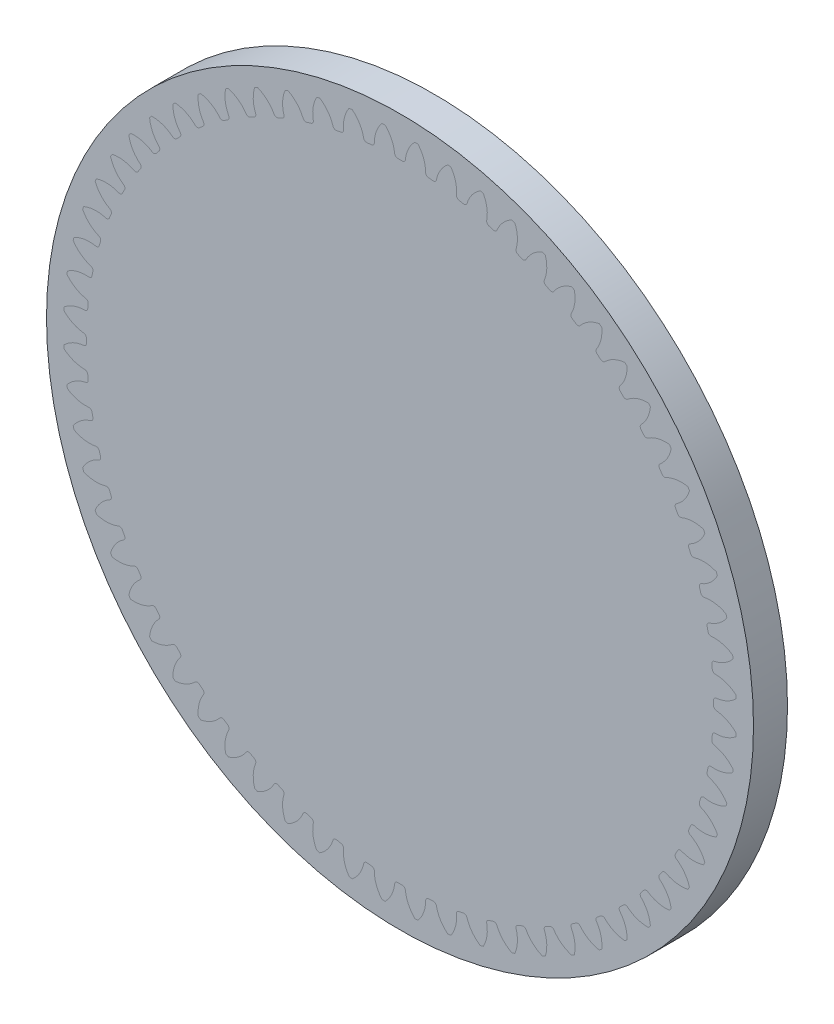
from build123d import *

# Parameters (mm, degrees)
SKETCH1_R                = 99
BOSS_EXTRUDE1_DEPTH      = 5
CUT_EXTRUDE1_DEPTH       = 141.096395385
FILLET1_R                = 0.9
CIRPATTERN1_COUNT        = 64
FILLET1_OF_CIRPATTERN1_R = 0.9
SKETCH3_R                = 104
BOSS_EXTRUDE2_DEPTH      = 5


with BuildPart() as part:
    # Sketch1 → Boss-Extrude1 (new, symmetric)
    with BuildSketch(Plane.XY):
        Circle(SKETCH1_R)
    extrude(amount=BOSS_EXTRUDE1_DEPTH, both=True)

    # Sketch2 → Cut-Extrude1 (cut, symmetric)
    with BuildSketch(Plane.XY):
        with BuildLine():
            ThreePointArc((-5.510991501, 99.848029388), (-2.618675254, 96.514378623), (-1.529900668, 92.23731297))
            ThreePointArc((-1.529900668, 92.23731297), (0, 92.25), (1.529900668, 92.23731297))
            ThreePointArc((1.529900668, 92.23731297), (2.618675254, 96.514378623), (5.510991501, 99.848029388))
            ThreePointArc((5.510991501, 99.848029388), (0, 100), (-5.510991501, 99.848029388))
        make_face()
    cut_extrude1 = extrude(amount=CUT_EXTRUDE1_DEPTH, both=True, mode=Mode.SUBTRACT)

    # Fillet1
    fillet1_edges = [part.edges().sort_by_distance(p)[0] for p in [
        (1.529900668, 92.23731297, 0),
        (-1.529900668, 92.23731297, 0),
    ]]
    fillet(fillet1_edges, radius=FILLET1_R)

    # CirPattern1: Cut-Extrude1 ×64 about axis
    cirpattern1_axis = Axis((0, 0, 5), (0, 0, 1))
    for i in range(1, CIRPATTERN1_COUNT):
        add(cut_extrude1.rotate(cirpattern1_axis, i * 360 / CIRPATTERN1_COUNT), mode=Mode.SUBTRACT)

    # Fillet1 of CirPattern1
    fillet1_of_cirpattern1_edges = [part.edges().sort_by_distance(p)[0] for p in [
        (-7.518303871, 91.943121586, 0),
        (-10.563371427, 91.643208609, 0),
        (-16.494103034, 90.763467679, 0),
        (-19.495111144, 90.166530051, 0),
        (-25.311054968, 88.709711962, 0),
        (-28.239102285, 87.821498519, 0),
        (-33.884247606, 85.801633226, 0),
        (-36.711135433, 84.630697948, 0),
        (-42.131116417, 82.067237857, 0),
        (-44.829620279, 80.624857492, 0),
        (-49.972239545, 77.542490125, 0),
        (-52.516371375, 75.842555585, 0),
        (-57.332102689, 72.270965825, 0),
        (-59.697361106, 70.329848407, 0),
        (-64.139826343, 66.303432616, 0),
        (-66.303432616, 64.139826343, 0),
        (-70.329848407, 59.697361106, 0),
        (-72.270965825, 57.332102689, 0),
        (-75.842555585, 52.516371375, 0),
        (-77.542490125, 49.972239545, 0),
        (-80.624857492, 44.829620279, 0),
        (-82.067237857, 42.131116417, 0),
        (-84.630697948, 36.711135433, 0),
        (-85.801633226, 33.884247606, 0),
        (-87.821498519, 28.239102285, 0),
        (-88.709711962, 25.311054968, 0),
        (-90.166530051, 19.495111144, 0),
        (-90.763467679, 16.494103034, 0),
        (-91.643208609, 10.563371427, 0),
        (-91.943121586, 7.518303871, 0),
        (-92.23731297, 1.529900668, 0),
        (-92.23731297, -1.529900668, 0),
        (-91.943121586, -7.518303871, 0),
        (-91.643208609, -10.563371427, 0),
        (-90.763467679, -16.494103034, 0),
        (-90.166530051, -19.495111144, 0),
        (-88.709711962, -25.311054968, 0),
        (-87.821498519, -28.239102285, 0),
        (-85.801633226, -33.884247606, 0),
        (-84.630697948, -36.711135433, 0),
        (-82.067237857, -42.131116417, 0),
        (-80.624857492, -44.829620279, 0),
        (-77.542490125, -49.972239545, 0),
        (-75.842555585, -52.516371375, 0),
        (-72.270965825, -57.332102689, 0),
        (-70.329848407, -59.697361106, 0),
        (-66.303432616, -64.139826343, 0),
        (-64.139826343, -66.303432616, 0),
        (-59.697361106, -70.329848407, 0),
        (-57.332102689, -72.270965825, 0),
        (-52.516371375, -75.842555585, 0),
        (-49.972239545, -77.542490125, 0),
        (-44.829620279, -80.624857492, 0),
        (-42.131116417, -82.067237857, 0),
        (-36.711135433, -84.630697948, 0),
        (-33.884247606, -85.801633226, 0),
        (-28.239102285, -87.821498519, 0),
        (-25.311054968, -88.709711962, 0),
        (-19.495111144, -90.166530051, 0),
        (-16.494103034, -90.763467679, 0),
        (-10.563371427, -91.643208609, 0),
        (-7.518303871, -91.943121586, 0),
        (-1.529900668, -92.23731297, 0),
        (1.529900668, -92.23731297, 0),
        (7.518303871, -91.943121586, 0),
        (10.563371427, -91.643208609, 0),
        (16.494103034, -90.763467679, 0),
        (19.495111144, -90.166530051, 0),
        (25.311054968, -88.709711962, 0),
        (28.239102285, -87.821498519, 0),
        (33.884247606, -85.801633226, 0),
        (36.711135433, -84.630697948, 0),
        (42.131116417, -82.067237857, 0),
        (44.829620279, -80.624857492, 0),
        (49.972239545, -77.542490125, 0),
        (52.516371375, -75.842555585, 0),
        (57.332102689, -72.270965825, 0),
        (59.697361106, -70.329848407, 0),
        (64.139826343, -66.303432616, 0),
        (66.303432616, -64.139826343, 0),
        (70.329848407, -59.697361106, 0),
        (72.270965825, -57.332102689, 0),
        (75.842555585, -52.516371375, 0),
        (77.542490125, -49.972239545, 0),
        (80.624857492, -44.829620279, 0),
        (82.067237857, -42.131116417, 0),
        (84.630697948, -36.711135433, 0),
        (85.801633226, -33.884247606, 0),
        (87.821498519, -28.239102285, 0),
        (88.709711962, -25.311054968, 0),
        (90.166530051, -19.495111144, 0),
        (90.763467679, -16.494103034, 0),
        (91.643208609, -10.563371427, 0),
        (91.943121586, -7.518303871, 0),
        (92.23731297, -1.529900668, 0),
        (92.23731297, 1.529900668, 0),
        (91.943121586, 7.518303871, 0),
        (91.643208609, 10.563371427, 0),
        (90.763467679, 16.494103034, 0),
        (90.166530051, 19.495111144, 0),
        (88.709711962, 25.311054968, 0),
        (87.821498519, 28.239102285, 0),
        (85.801633226, 33.884247606, 0),
        (84.630697948, 36.711135433, 0),
        (82.067237857, 42.131116417, 0),
        (80.624857492, 44.829620279, 0),
        (77.542490125, 49.972239545, 0),
        (75.842555585, 52.516371375, 0),
        (72.270965825, 57.332102689, 0),
        (70.329848407, 59.697361106, 0),
        (66.303432616, 64.139826343, 0),
        (64.139826343, 66.303432616, 0),
        (59.697361106, 70.329848407, 0),
        (57.332102689, 72.270965825, 0),
        (52.516371375, 75.842555585, 0),
        (49.972239545, 77.542490125, 0),
        (44.829620279, 80.624857492, 0),
        (42.131116417, 82.067237857, 0),
        (36.711135433, 84.630697948, 0),
        (33.884247606, 85.801633226, 0),
        (28.239102285, 87.821498519, 0),
        (25.311054968, 88.709711962, 0),
        (19.495111144, 90.166530051, 0),
        (16.494103034, 90.763467679, 0),
        (10.563371427, 91.643208609, 0),
        (7.518303871, 91.943121586, 0),
    ]]
    fillet(fillet1_of_cirpattern1_edges, radius=FILLET1_OF_CIRPATTERN1_R)


with BuildPart() as body_2:
    # Sketch3 → Boss-Extrude2 (new, symmetric)
    with BuildSketch(Plane.XY):
        Circle(SKETCH3_R)
        with BuildLine():
            ThreePointArc((-5.326203619, 98.8566212), (-6.970296204, 96.003625646), (-7.550059318, 92.762252667))
            ThreePointArc((-7.550059318, 92.762252667), (-7.786660643, 92.157733228), (-8.368408763, 91.869648061))
            ThreePointArc((-8.368408763, 91.869648061), (-9.042081195, 91.805791036), (-9.715267088, 91.736994094))
            ThreePointArc((-9.715267088, 91.736994094), (-10.34203971, 91.906050358), (-10.692030698, 92.452795496))
            ThreePointArc((-10.692030698, 92.452795496), (-11.893014325, 95.51878023), (-14.062107954, 97.996209722))
            ThreePointArc((-14.062107954, 97.996209722), (-14.526316971, 97.928474487), (-14.990199805, 97.858540301))
            ThreePointArc((-14.990199805, 97.858540301), (-16.34673317, 94.858133447), (-16.605994456, 91.575541842))
            ThreePointArc((-16.605994456, 91.575541842), (-16.782203214, 90.950742344), (-17.332912774, 90.607023099))
            ThreePointArc((-17.332912774, 90.607023099), (-17.997082206, 90.477442117), (-18.660283245, 90.342992696))
            ThreePointArc((-18.660283245, 90.342992696), (-19.300608197, 90.449800447), (-19.702504278, 90.959607743))
            ThreePointArc((-19.702504278, 90.959607743), (-21.198223896, 93.893111941), (-23.5997033, 96.146003579))
            ThreePointArc((-23.5997033, 96.146003579), (-24.05503781, 96.033094066), (-24.509832173, 95.918028164))
            ThreePointArc((-24.509832173, 95.918028164), (-25.565742159, 92.799105568), (-25.502004789, 89.506908489))
            ThreePointArc((-25.502004789, 89.506908489), (-25.616123994, 88.867846093), (-26.130491359, 88.471802973))
            ThreePointArc((-26.130491359, 88.471802973), (-26.778761477, 88.277745971), (-27.425590674, 88.078938891))
            ThreePointArc((-27.425590674, 88.078938891), (-28.073301276, 88.122469513), (-28.523231971, 88.590429243))
            ThreePointArc((-28.523231971, 88.590429243), (-30.299282983, 91.363201657), (-32.910020603, 93.369858862))
            ThreePointArc((-32.910020603, 93.369858862), (-33.352095486, 93.212862453), (-33.793421459, 93.053772982))
            ThreePointArc((-33.793421459, 93.053772982), (-34.538539076, 89.846371573), (-34.152416875, 86.576274678))
            ThreePointArc((-34.152416875, 86.576274678), (-34.203347496, 85.929103904), (-34.676419028, 85.484551022))
            ThreePointArc((-34.676419028, 85.484551022), (-35.302546636, 85.227886874), (-35.926774672, 84.966636756))
            ThreePointArc((-35.926774672, 84.966636756), (-36.575633118, 84.946471026), (-37.069265348, 85.368076481))
            ThreePointArc((-37.069265348, 85.368076481), (-39.108543412, 87.953413797), (-41.903396417, 89.694511363))
            ThreePointArc((-41.903396417, 89.694511363), (-42.32795425, 89.494940019), (-42.751561622, 89.293359097))
            ThreePointArc((-42.751561622, 89.293359097), (-43.17871098, 86.028367905), (-42.473922518, 82.811864014))
            ThreePointArc((-42.473922518, 82.811864014), (-42.461174065, 82.16281747), (-42.888393826, 81.674036113))
            ThreePointArc((-42.888393826, 81.674036113), (-43.486348972, 81.357236636), (-44.081964191, 81.036059462))
            ThreePointArc((-44.081964191, 81.036059462), (-44.725721618, 80.952391586), (-45.258301436, 81.323582476))
            ThreePointArc((-45.258301436, 81.323582476), (-47.541167188, 83.696586482), (-50.493219617, 85.155356688))
            ThreePointArc((-50.493219617, 85.155356688), (-50.896171675, 84.91513239), (-51.297980877, 84.673001352))
            ThreePointArc((-51.297980877, 84.673001352), (-51.403048294, 81.381864026), (-50.386381067, 78.24992983))
            ThreePointArc((-50.386381067, 78.24992983), (-50.310076316, 77.60525819), (-50.687329946, 77.076955589))
            ThreePointArc((-50.687329946, 77.076955589), (-51.251353996, 76.703071735), (-51.812620296, 76.325060616))
            ThreePointArc((-51.812620296, 76.325060616), (-52.44507697, 76.178696361), (-53.011475339, 76.495897915))
            ThreePointArc((-53.011475339, 76.495897915), (-55.515943536, 78.633715286), (-58.59676551, 79.796109377))
            ThreePointArc((-58.59676551, 79.796109377), (-58.974231145, 79.517545617), (-59.350372533, 79.237196317))
            ThreePointArc((-59.350372533, 79.237196317), (-59.132346153, 75.951608309), (-57.813591223, 72.934406047))
            ThreePointArc((-57.813591223, 72.934406047), (-57.67446503, 72.30031785), (-57.99811937, 71.737581849))
            ThreePointArc((-57.99811937, 71.737581849), (-58.522780464, 71.310214323), (-59.044292545, 70.879009713))
            ThreePointArc((-59.044292545, 70.879009713), (-59.659357561, 70.671358648), (-60.254119757, 70.931516041))
            ThreePointArc((-60.254119757, 70.931516041), (-62.956071, 72.813558426), (-66.135992519, 73.668381912))
            ThreePointArc((-66.135992519, 73.668381912), (-66.48433653, 73.35416141), (-66.831187658, 73.038293766))
            ThreePointArc((-66.831187658, 73.038293766), (-66.292167194, 69.789897085), (-64.684024892, 66.916484063))
            ThreePointArc((-64.684024892, 66.916484063), (-64.483417117, 66.299085926), (-64.7503552, 65.707335979))
            ThreePointArc((-64.7503552, 65.707335979), (-65.230600564, 65.230600564), (-65.707335979, 64.7503552))
            ThreePointArc((-65.707335979, 64.7503552), (-66.299085926, 64.483417117), (-66.916484063, 64.684024892))
            ThreePointArc((-66.916484063, 64.684024892), (-69.789897085, 66.292167194), (-73.038293766, 66.831187658))
            ThreePointArc((-73.038293766, 66.831187658), (-73.35416141, 66.48433653), (-73.668381912, 66.135992519))
            ThreePointArc((-73.668381912, 66.135992519), (-72.813558426, 62.956071), (-70.931516041, 60.254119757))
            ThreePointArc((-70.931516041, 60.254119757), (-70.671358648, 59.659357561), (-70.879009713, 59.044292545))
            ThreePointArc((-70.879009713, 59.044292545), (-71.310214323, 58.522780464), (-71.737581849, 57.99811937))
            ThreePointArc((-71.737581849, 57.99811937), (-72.30031785, 57.67446503), (-72.934406047, 57.813591223))
            ThreePointArc((-72.934406047, 57.813591223), (-75.951608309, 59.132346153), (-79.237196317, 59.350372533))
            ThreePointArc((-79.237196317, 59.350372533), (-79.517545617, 58.974231145), (-79.796109377, 58.59676551))
            ThreePointArc((-79.796109377, 58.59676551), (-78.633715286, 55.515943536), (-76.495897915, 53.011475339))
            ThreePointArc((-76.495897915, 53.011475339), (-76.178696361, 52.44507697), (-76.325060616, 51.812620296))
            ThreePointArc((-76.325060616, 51.812620296), (-76.703071735, 51.251353996), (-77.076955589, 50.687329946))
            ThreePointArc((-77.076955589, 50.687329946), (-77.60525819, 50.310076316), (-78.24992983, 50.386381067))
            ThreePointArc((-78.24992983, 50.386381067), (-81.381864026, 51.403048294), (-84.673001352, 51.297980877))
            ThreePointArc((-84.673001352, 51.297980877), (-84.91513239, 50.896171675), (-85.155356688, 50.493219617))
            ThreePointArc((-85.155356688, 50.493219617), (-83.696586482, 47.541167188), (-81.323582476, 45.258301436))
            ThreePointArc((-81.323582476, 45.258301436), (-80.952391586, 44.725721618), (-81.036059462, 44.081964191))
            ThreePointArc((-81.036059462, 44.081964191), (-81.357236636, 43.486348972), (-81.674036113, 42.888393826))
            ThreePointArc((-81.674036113, 42.888393826), (-82.16281747, 42.461174065), (-82.811864014, 42.473922518))
            ThreePointArc((-82.811864014, 42.473922518), (-86.028367905, 43.17871098), (-89.293359097, 42.751561622))
            ThreePointArc((-89.293359097, 42.751561622), (-89.494940019, 42.32795425), (-89.694511363, 41.903396417))
            ThreePointArc((-89.694511363, 41.903396417), (-87.953413797, 39.108543412), (-85.368076481, 37.069265348))
            ThreePointArc((-85.368076481, 37.069265348), (-84.946471026, 36.575633118), (-84.966636756, 35.926774672))
            ThreePointArc((-84.966636756, 35.926774672), (-85.227886874, 35.302546636), (-85.484551022, 34.676419028))
            ThreePointArc((-85.484551022, 34.676419028), (-85.929103904, 34.203347496), (-86.576274678, 34.152416875))
            ThreePointArc((-86.576274678, 34.152416875), (-89.846371573, 34.538539076), (-93.053772982, 33.793421459))
            ThreePointArc((-93.053772982, 33.793421459), (-93.212862453, 33.352095486), (-93.369858862, 32.910020603))
            ThreePointArc((-93.369858862, 32.910020603), (-91.363201657, 30.299282983), (-88.590429243, 28.523231971))
            ThreePointArc((-88.590429243, 28.523231971), (-88.122469513, 28.073301276), (-88.078938891, 27.425590674))
            ThreePointArc((-88.078938891, 27.425590674), (-88.277745971, 26.778761477), (-88.471802973, 26.130491359))
            ThreePointArc((-88.471802973, 26.130491359), (-88.867846093, 25.616123994), (-89.506908489, 25.502004789))
            ThreePointArc((-89.506908489, 25.502004789), (-92.799105568, 25.565742159), (-95.918028164, 24.509832173))
            ThreePointArc((-95.918028164, 24.509832173), (-96.033094066, 24.05503781), (-96.146003579, 23.5997033))
            ThreePointArc((-96.146003579, 23.5997033), (-93.893111941, 21.198223896), (-90.959607743, 19.702504278))
            ThreePointArc((-90.959607743, 19.702504278), (-90.449800447, 19.300608197), (-90.342992696, 18.660283245))
            ThreePointArc((-90.342992696, 18.660283245), (-90.477442117, 17.997082206), (-90.607023099, 17.332912774))
            ThreePointArc((-90.607023099, 17.332912774), (-90.950742344, 16.782203214), (-91.575541842, 16.605994456))
            ThreePointArc((-91.575541842, 16.605994456), (-94.858133447, 16.34673317), (-97.858540301, 14.990199805))
            ThreePointArc((-97.858540301, 14.990199805), (-97.928474487, 14.526316971), (-97.996209722, 14.062107954))
            ThreePointArc((-97.996209722, 14.062107954), (-95.51878023, 11.893014325), (-92.452795496, 10.692030698))
            ThreePointArc((-92.452795496, 10.692030698), (-91.906050358, 10.34203971), (-91.736994094, 9.715267088))
            ThreePointArc((-91.736994094, 9.715267088), (-91.805791036, 9.042081195), (-91.869648061, 8.368408763))
            ThreePointArc((-91.869648061, 8.368408763), (-92.157733228, 7.786660643), (-92.762252667, 7.550059318))
            ThreePointArc((-92.762252667, 7.550059318), (-96.003625646, 6.970296204), (-98.8566212, 5.326203619))
            ThreePointArc((-98.8566212, 5.326203619), (-98.880750164, 4.857699758), (-98.902658796, 4.38908682))
            ThreePointArc((-98.902658796, 4.38908682), (-96.224550449, 2.473268524), (-93.055612289, 1.578587018))
            ThreePointArc((-93.055612289, 1.578587018), (-92.477194762, 1.283871727), (-92.247518091, 0.676687598))
            ThreePointArc((-92.247518091, 0.676687598), (-92.25, 0), (-92.247518091, -0.676687598))
            ThreePointArc((-92.247518091, -0.676687598), (-92.477194762, -1.283871727), (-93.055612289, -1.578587018))
            ThreePointArc((-93.055612289, -1.578587018), (-96.224550449, -2.473268524), (-98.902658796, -4.38908682))
            ThreePointArc((-98.902658796, -4.38908682), (-98.880750164, -4.857699758), (-98.8566212, -5.326203619))
            ThreePointArc((-98.8566212, -5.326203619), (-96.003625646, -6.970296204), (-92.762252667, -7.550059318))
            ThreePointArc((-92.762252667, -7.550059318), (-92.157733228, -7.786660643), (-91.869648061, -8.368408763))
            ThreePointArc((-91.869648061, -8.368408763), (-91.805791036, -9.042081195), (-91.736994094, -9.715267088))
            ThreePointArc((-91.736994094, -9.715267088), (-91.906050358, -10.34203971), (-92.452795496, -10.692030698))
            ThreePointArc((-92.452795496, -10.692030698), (-95.51878023, -11.893014325), (-97.996209722, -14.062107954))
            ThreePointArc((-97.996209722, -14.062107954), (-97.928474487, -14.526316971), (-97.858540301, -14.990199805))
            ThreePointArc((-97.858540301, -14.990199805), (-94.858133447, -16.34673317), (-91.575541842, -16.605994456))
            ThreePointArc((-91.575541842, -16.605994456), (-90.950742344, -16.782203214), (-90.607023099, -17.332912774))
            ThreePointArc((-90.607023099, -17.332912774), (-90.477442117, -17.997082206), (-90.342992696, -18.660283245))
            ThreePointArc((-90.342992696, -18.660283245), (-90.449800447, -19.300608197), (-90.959607743, -19.702504278))
            ThreePointArc((-90.959607743, -19.702504278), (-93.893111941, -21.198223896), (-96.146003579, -23.5997033))
            ThreePointArc((-96.146003579, -23.5997033), (-96.033094066, -24.05503781), (-95.918028164, -24.509832173))
            ThreePointArc((-95.918028164, -24.509832173), (-92.799105568, -25.565742159), (-89.506908489, -25.502004789))
            ThreePointArc((-89.506908489, -25.502004789), (-88.867846093, -25.616123994), (-88.471802973, -26.130491359))
            ThreePointArc((-88.471802973, -26.130491359), (-88.277745971, -26.778761477), (-88.078938891, -27.425590674))
            ThreePointArc((-88.078938891, -27.425590674), (-88.122469513, -28.073301276), (-88.590429243, -28.523231971))
            ThreePointArc((-88.590429243, -28.523231971), (-91.363201657, -30.299282983), (-93.369858862, -32.910020603))
            ThreePointArc((-93.369858862, -32.910020603), (-93.212862453, -33.352095486), (-93.053772982, -33.793421459))
            ThreePointArc((-93.053772982, -33.793421459), (-89.846371573, -34.538539076), (-86.576274678, -34.152416875))
            ThreePointArc((-86.576274678, -34.152416875), (-85.929103904, -34.203347496), (-85.484551022, -34.676419028))
            ThreePointArc((-85.484551022, -34.676419028), (-85.227886874, -35.302546636), (-84.966636756, -35.926774672))
            ThreePointArc((-84.966636756, -35.926774672), (-84.946471026, -36.575633118), (-85.368076481, -37.069265348))
            ThreePointArc((-85.368076481, -37.069265348), (-87.953413797, -39.108543412), (-89.694511363, -41.903396417))
            ThreePointArc((-89.694511363, -41.903396417), (-89.494940019, -42.32795425), (-89.293359097, -42.751561622))
            ThreePointArc((-89.293359097, -42.751561622), (-86.028367905, -43.17871098), (-82.811864014, -42.473922518))
            ThreePointArc((-82.811864014, -42.473922518), (-82.16281747, -42.461174065), (-81.674036113, -42.888393826))
            ThreePointArc((-81.674036113, -42.888393826), (-81.357236636, -43.486348972), (-81.036059462, -44.081964191))
            ThreePointArc((-81.036059462, -44.081964191), (-80.952391586, -44.725721618), (-81.323582476, -45.258301436))
            ThreePointArc((-81.323582476, -45.258301436), (-83.696586482, -47.541167188), (-85.155356688, -50.493219617))
            ThreePointArc((-85.155356688, -50.493219617), (-84.91513239, -50.896171675), (-84.673001352, -51.297980877))
            ThreePointArc((-84.673001352, -51.297980877), (-81.381864026, -51.403048294), (-78.24992983, -50.386381067))
            ThreePointArc((-78.24992983, -50.386381067), (-77.60525819, -50.310076316), (-77.076955589, -50.687329946))
            ThreePointArc((-77.076955589, -50.687329946), (-76.703071735, -51.251353996), (-76.325060616, -51.812620296))
            ThreePointArc((-76.325060616, -51.812620296), (-76.178696361, -52.44507697), (-76.495897915, -53.011475339))
            ThreePointArc((-76.495897915, -53.011475339), (-78.633715286, -55.515943536), (-79.796109377, -58.59676551))
            ThreePointArc((-79.796109377, -58.59676551), (-79.517545617, -58.974231145), (-79.237196317, -59.350372533))
            ThreePointArc((-79.237196317, -59.350372533), (-75.951608309, -59.132346153), (-72.934406047, -57.813591223))
            ThreePointArc((-72.934406047, -57.813591223), (-72.30031785, -57.67446503), (-71.737581849, -57.99811937))
            ThreePointArc((-71.737581849, -57.99811937), (-71.310214323, -58.522780464), (-70.879009713, -59.044292545))
            ThreePointArc((-70.879009713, -59.044292545), (-70.671358648, -59.659357561), (-70.931516041, -60.254119757))
            ThreePointArc((-70.931516041, -60.254119757), (-72.813558426, -62.956071), (-73.668381912, -66.135992519))
            ThreePointArc((-73.668381912, -66.135992519), (-73.35416141, -66.48433653), (-73.038293766, -66.831187658))
            ThreePointArc((-73.038293766, -66.831187658), (-69.789897085, -66.292167194), (-66.916484063, -64.684024892))
            ThreePointArc((-66.916484063, -64.684024892), (-66.299085926, -64.483417117), (-65.707335979, -64.7503552))
            ThreePointArc((-65.707335979, -64.7503552), (-65.230600564, -65.230600564), (-64.7503552, -65.707335979))
            ThreePointArc((-64.7503552, -65.707335979), (-64.483417117, -66.299085926), (-64.684024892, -66.916484063))
            ThreePointArc((-64.684024892, -66.916484063), (-66.292167194, -69.789897085), (-66.831187658, -73.038293766))
            ThreePointArc((-66.831187658, -73.038293766), (-66.48433653, -73.35416141), (-66.135992519, -73.668381912))
            ThreePointArc((-66.135992519, -73.668381912), (-62.956071, -72.813558426), (-60.254119757, -70.931516041))
            ThreePointArc((-60.254119757, -70.931516041), (-59.659357561, -70.671358648), (-59.044292545, -70.879009713))
            ThreePointArc((-59.044292545, -70.879009713), (-58.522780464, -71.310214323), (-57.99811937, -71.737581849))
            ThreePointArc((-57.99811937, -71.737581849), (-57.67446503, -72.30031785), (-57.813591223, -72.934406047))
            ThreePointArc((-57.813591223, -72.934406047), (-59.132346153, -75.951608309), (-59.350372533, -79.237196317))
            ThreePointArc((-59.350372533, -79.237196317), (-58.974231145, -79.517545617), (-58.59676551, -79.796109377))
            ThreePointArc((-58.59676551, -79.796109377), (-55.515943536, -78.633715286), (-53.011475339, -76.495897915))
            ThreePointArc((-53.011475339, -76.495897915), (-52.44507697, -76.178696361), (-51.812620296, -76.325060616))
            ThreePointArc((-51.812620296, -76.325060616), (-51.251353996, -76.703071735), (-50.687329946, -77.076955589))
            ThreePointArc((-50.687329946, -77.076955589), (-50.310076316, -77.60525819), (-50.386381067, -78.24992983))
            ThreePointArc((-50.386381067, -78.24992983), (-51.403048294, -81.381864026), (-51.297980877, -84.673001352))
            ThreePointArc((-51.297980877, -84.673001352), (-50.896171675, -84.91513239), (-50.493219617, -85.155356688))
            ThreePointArc((-50.493219617, -85.155356688), (-47.541167188, -83.696586482), (-45.258301436, -81.323582476))
            ThreePointArc((-45.258301436, -81.323582476), (-44.725721618, -80.952391586), (-44.081964191, -81.036059462))
            ThreePointArc((-44.081964191, -81.036059462), (-43.486348972, -81.357236636), (-42.888393826, -81.674036113))
            ThreePointArc((-42.888393826, -81.674036113), (-42.461174065, -82.16281747), (-42.473922518, -82.811864014))
            ThreePointArc((-42.473922518, -82.811864014), (-43.17871098, -86.028367905), (-42.751561622, -89.293359097))
            ThreePointArc((-42.751561622, -89.293359097), (-42.32795425, -89.494940019), (-41.903396417, -89.694511363))
            ThreePointArc((-41.903396417, -89.694511363), (-39.108543412, -87.953413797), (-37.069265348, -85.368076481))
            ThreePointArc((-37.069265348, -85.368076481), (-36.575633118, -84.946471026), (-35.926774672, -84.966636756))
            ThreePointArc((-35.926774672, -84.966636756), (-35.302546636, -85.227886874), (-34.676419028, -85.484551022))
            ThreePointArc((-34.676419028, -85.484551022), (-34.203347496, -85.929103904), (-34.152416875, -86.576274678))
            ThreePointArc((-34.152416875, -86.576274678), (-34.538539076, -89.846371573), (-33.793421459, -93.053772982))
            ThreePointArc((-33.793421459, -93.053772982), (-33.352095486, -93.212862453), (-32.910020603, -93.369858862))
            ThreePointArc((-32.910020603, -93.369858862), (-30.299282983, -91.363201657), (-28.523231971, -88.590429243))
            ThreePointArc((-28.523231971, -88.590429243), (-28.073301276, -88.122469513), (-27.425590674, -88.078938891))
            ThreePointArc((-27.425590674, -88.078938891), (-26.778761477, -88.277745971), (-26.130491359, -88.471802973))
            ThreePointArc((-26.130491359, -88.471802973), (-25.616123994, -88.867846093), (-25.502004789, -89.506908489))
            ThreePointArc((-25.502004789, -89.506908489), (-25.565742159, -92.799105568), (-24.509832173, -95.918028164))
            ThreePointArc((-24.509832173, -95.918028164), (-24.05503781, -96.033094066), (-23.5997033, -96.146003579))
            ThreePointArc((-23.5997033, -96.146003579), (-21.198223896, -93.893111941), (-19.702504278, -90.959607743))
            ThreePointArc((-19.702504278, -90.959607743), (-19.300608197, -90.449800447), (-18.660283245, -90.342992696))
            ThreePointArc((-18.660283245, -90.342992696), (-17.997082206, -90.477442117), (-17.332912774, -90.607023099))
            ThreePointArc((-17.332912774, -90.607023099), (-16.782203214, -90.950742344), (-16.605994456, -91.575541842))
            ThreePointArc((-16.605994456, -91.575541842), (-16.34673317, -94.858133447), (-14.990199805, -97.858540301))
            ThreePointArc((-14.990199805, -97.858540301), (-14.526316971, -97.928474487), (-14.062107954, -97.996209722))
            ThreePointArc((-14.062107954, -97.996209722), (-11.893014325, -95.51878023), (-10.692030698, -92.452795496))
            ThreePointArc((-10.692030698, -92.452795496), (-10.34203971, -91.906050358), (-9.715267088, -91.736994094))
            ThreePointArc((-9.715267088, -91.736994094), (-9.042081195, -91.805791036), (-8.368408763, -91.869648061))
            ThreePointArc((-8.368408763, -91.869648061), (-7.786660643, -92.157733228), (-7.550059318, -92.762252667))
            ThreePointArc((-7.550059318, -92.762252667), (-6.970296204, -96.003625646), (-5.326203619, -98.8566212))
            ThreePointArc((-5.326203619, -98.8566212), (-4.857699758, -98.880750164), (-4.38908682, -98.902658796))
            ThreePointArc((-4.38908682, -98.902658796), (-2.473268524, -96.224550449), (-1.578587018, -93.055612289))
            ThreePointArc((-1.578587018, -93.055612289), (-1.283871727, -92.477194762), (-0.676687598, -92.247518091))
            ThreePointArc((-0.676687598, -92.247518091), (0, -92.25), (0.676687598, -92.247518091))
            ThreePointArc((0.676687598, -92.247518091), (1.283871727, -92.477194762), (1.578587018, -93.055612289))
            ThreePointArc((1.578587018, -93.055612289), (2.473268524, -96.224550449), (4.38908682, -98.902658796))
            ThreePointArc((4.38908682, -98.902658796), (4.857699758, -98.880750164), (5.326203619, -98.8566212))
            ThreePointArc((5.326203619, -98.8566212), (6.970296204, -96.003625646), (7.550059318, -92.762252667))
            ThreePointArc((7.550059318, -92.762252667), (7.786660643, -92.157733228), (8.368408763, -91.869648061))
            ThreePointArc((8.368408763, -91.869648061), (9.042081195, -91.805791036), (9.715267088, -91.736994094))
            ThreePointArc((9.715267088, -91.736994094), (10.34203971, -91.906050358), (10.692030698, -92.452795496))
            ThreePointArc((10.692030698, -92.452795496), (11.893014325, -95.51878023), (14.062107954, -97.996209722))
            ThreePointArc((14.062107954, -97.996209722), (14.526316971, -97.928474487), (14.990199805, -97.858540301))
            ThreePointArc((14.990199805, -97.858540301), (16.34673317, -94.858133447), (16.605994456, -91.575541842))
            ThreePointArc((16.605994456, -91.575541842), (16.782203214, -90.950742344), (17.332912774, -90.607023099))
            ThreePointArc((17.332912774, -90.607023099), (17.997082206, -90.477442117), (18.660283245, -90.342992696))
            ThreePointArc((18.660283245, -90.342992696), (19.300608197, -90.449800447), (19.702504278, -90.959607743))
            ThreePointArc((19.702504278, -90.959607743), (21.198223896, -93.893111941), (23.5997033, -96.146003579))
            ThreePointArc((23.5997033, -96.146003579), (24.05503781, -96.033094066), (24.509832173, -95.918028164))
            ThreePointArc((24.509832173, -95.918028164), (25.565742159, -92.799105568), (25.502004789, -89.506908489))
            ThreePointArc((25.502004789, -89.506908489), (25.616123994, -88.867846093), (26.130491359, -88.471802973))
            ThreePointArc((26.130491359, -88.471802973), (26.778761477, -88.277745971), (27.425590674, -88.078938891))
            ThreePointArc((27.425590674, -88.078938891), (28.073301276, -88.122469513), (28.523231971, -88.590429243))
            ThreePointArc((28.523231971, -88.590429243), (30.299282983, -91.363201657), (32.910020603, -93.369858862))
            ThreePointArc((32.910020603, -93.369858862), (33.352095486, -93.212862453), (33.793421459, -93.053772982))
            ThreePointArc((33.793421459, -93.053772982), (34.538539076, -89.846371573), (34.152416875, -86.576274678))
            ThreePointArc((34.152416875, -86.576274678), (34.203347496, -85.929103904), (34.676419028, -85.484551022))
            ThreePointArc((34.676419028, -85.484551022), (35.302546636, -85.227886874), (35.926774672, -84.966636756))
            ThreePointArc((35.926774672, -84.966636756), (36.575633118, -84.946471026), (37.069265348, -85.368076481))
            ThreePointArc((37.069265348, -85.368076481), (39.108543412, -87.953413797), (41.903396417, -89.694511363))
            ThreePointArc((41.903396417, -89.694511363), (42.32795425, -89.494940019), (42.751561622, -89.293359097))
            ThreePointArc((42.751561622, -89.293359097), (43.17871098, -86.028367905), (42.473922518, -82.811864014))
            ThreePointArc((42.473922518, -82.811864014), (42.461174065, -82.16281747), (42.888393826, -81.674036113))
            ThreePointArc((42.888393826, -81.674036113), (43.486348972, -81.357236636), (44.081964191, -81.036059462))
            ThreePointArc((44.081964191, -81.036059462), (44.725721618, -80.952391586), (45.258301436, -81.323582476))
            ThreePointArc((45.258301436, -81.323582476), (47.541167188, -83.696586482), (50.493219617, -85.155356688))
            ThreePointArc((50.493219617, -85.155356688), (50.896171675, -84.91513239), (51.297980877, -84.673001352))
            ThreePointArc((51.297980877, -84.673001352), (51.403048294, -81.381864026), (50.386381067, -78.24992983))
            ThreePointArc((50.386381067, -78.24992983), (50.310076316, -77.60525819), (50.687329946, -77.076955589))
            ThreePointArc((50.687329946, -77.076955589), (51.251353996, -76.703071735), (51.812620296, -76.325060616))
            ThreePointArc((51.812620296, -76.325060616), (52.44507697, -76.178696361), (53.011475339, -76.495897915))
            ThreePointArc((53.011475339, -76.495897915), (55.515943536, -78.633715286), (58.59676551, -79.796109377))
            ThreePointArc((58.59676551, -79.796109377), (58.974231145, -79.517545617), (59.350372533, -79.237196317))
            ThreePointArc((59.350372533, -79.237196317), (59.132346153, -75.951608309), (57.813591223, -72.934406047))
            ThreePointArc((57.813591223, -72.934406047), (57.67446503, -72.30031785), (57.99811937, -71.737581849))
            ThreePointArc((57.99811937, -71.737581849), (58.522780464, -71.310214323), (59.044292545, -70.879009713))
            ThreePointArc((59.044292545, -70.879009713), (59.659357561, -70.671358648), (60.254119757, -70.931516041))
            ThreePointArc((60.254119757, -70.931516041), (62.956071, -72.813558426), (66.135992519, -73.668381912))
            ThreePointArc((66.135992519, -73.668381912), (66.48433653, -73.35416141), (66.831187658, -73.038293766))
            ThreePointArc((66.831187658, -73.038293766), (66.292167194, -69.789897085), (64.684024892, -66.916484063))
            ThreePointArc((64.684024892, -66.916484063), (64.483417117, -66.299085926), (64.7503552, -65.707335979))
            ThreePointArc((64.7503552, -65.707335979), (65.230600564, -65.230600564), (65.707335979, -64.7503552))
            ThreePointArc((65.707335979, -64.7503552), (66.299085926, -64.483417117), (66.916484063, -64.684024892))
            ThreePointArc((66.916484063, -64.684024892), (69.789897085, -66.292167194), (73.038293766, -66.831187658))
            ThreePointArc((73.038293766, -66.831187658), (73.35416141, -66.48433653), (73.668381912, -66.135992519))
            ThreePointArc((73.668381912, -66.135992519), (72.813558426, -62.956071), (70.931516041, -60.254119757))
            ThreePointArc((70.931516041, -60.254119757), (70.671358648, -59.659357561), (70.879009713, -59.044292545))
            ThreePointArc((70.879009713, -59.044292545), (71.310214323, -58.522780464), (71.737581849, -57.99811937))
            ThreePointArc((71.737581849, -57.99811937), (72.30031785, -57.67446503), (72.934406047, -57.813591223))
            ThreePointArc((72.934406047, -57.813591223), (75.951608309, -59.132346153), (79.237196317, -59.350372533))
            ThreePointArc((79.237196317, -59.350372533), (79.517545617, -58.974231145), (79.796109377, -58.59676551))
            ThreePointArc((79.796109377, -58.59676551), (78.633715286, -55.515943536), (76.495897915, -53.011475339))
            ThreePointArc((76.495897915, -53.011475339), (76.178696361, -52.44507697), (76.325060616, -51.812620296))
            ThreePointArc((76.325060616, -51.812620296), (76.703071735, -51.251353996), (77.076955589, -50.687329946))
            ThreePointArc((77.076955589, -50.687329946), (77.60525819, -50.310076316), (78.24992983, -50.386381067))
            ThreePointArc((78.24992983, -50.386381067), (81.381864026, -51.403048294), (84.673001352, -51.297980877))
            ThreePointArc((84.673001352, -51.297980877), (84.91513239, -50.896171675), (85.155356688, -50.493219617))
            ThreePointArc((85.155356688, -50.493219617), (83.696586482, -47.541167188), (81.323582476, -45.258301436))
            ThreePointArc((81.323582476, -45.258301436), (80.952391586, -44.725721618), (81.036059462, -44.081964191))
            ThreePointArc((81.036059462, -44.081964191), (81.357236636, -43.486348972), (81.674036113, -42.888393826))
            ThreePointArc((81.674036113, -42.888393826), (82.16281747, -42.461174065), (82.811864014, -42.473922518))
            ThreePointArc((82.811864014, -42.473922518), (86.028367905, -43.17871098), (89.293359097, -42.751561622))
            ThreePointArc((89.293359097, -42.751561622), (89.494940019, -42.32795425), (89.694511363, -41.903396417))
            ThreePointArc((89.694511363, -41.903396417), (87.953413797, -39.108543412), (85.368076481, -37.069265348))
            ThreePointArc((85.368076481, -37.069265348), (84.946471026, -36.575633118), (84.966636756, -35.926774672))
            ThreePointArc((84.966636756, -35.926774672), (85.227886874, -35.302546636), (85.484551022, -34.676419028))
            ThreePointArc((85.484551022, -34.676419028), (85.929103904, -34.203347496), (86.576274678, -34.152416875))
            ThreePointArc((86.576274678, -34.152416875), (89.846371573, -34.538539076), (93.053772982, -33.793421459))
            ThreePointArc((93.053772982, -33.793421459), (93.212862453, -33.352095486), (93.369858862, -32.910020603))
            ThreePointArc((93.369858862, -32.910020603), (91.363201657, -30.299282983), (88.590429243, -28.523231971))
            ThreePointArc((88.590429243, -28.523231971), (88.122469513, -28.073301276), (88.078938891, -27.425590674))
            ThreePointArc((88.078938891, -27.425590674), (88.277745971, -26.778761477), (88.471802973, -26.130491359))
            ThreePointArc((88.471802973, -26.130491359), (88.867846093, -25.616123994), (89.506908489, -25.502004789))
            ThreePointArc((89.506908489, -25.502004789), (92.799105568, -25.565742159), (95.918028164, -24.509832173))
            ThreePointArc((95.918028164, -24.509832173), (96.033094066, -24.05503781), (96.146003579, -23.5997033))
            ThreePointArc((96.146003579, -23.5997033), (93.893111941, -21.198223896), (90.959607743, -19.702504278))
            ThreePointArc((90.959607743, -19.702504278), (90.449800447, -19.300608197), (90.342992696, -18.660283245))
            ThreePointArc((90.342992696, -18.660283245), (90.477442117, -17.997082206), (90.607023099, -17.332912774))
            ThreePointArc((90.607023099, -17.332912774), (90.950742344, -16.782203214), (91.575541842, -16.605994456))
            ThreePointArc((91.575541842, -16.605994456), (94.858133447, -16.34673317), (97.858540301, -14.990199805))
            ThreePointArc((97.858540301, -14.990199805), (97.928474487, -14.526316971), (97.996209722, -14.062107954))
            ThreePointArc((97.996209722, -14.062107954), (95.51878023, -11.893014325), (92.452795496, -10.692030698))
            ThreePointArc((92.452795496, -10.692030698), (91.906050358, -10.34203971), (91.736994094, -9.715267088))
            ThreePointArc((91.736994094, -9.715267088), (91.805791036, -9.042081195), (91.869648061, -8.368408763))
            ThreePointArc((91.869648061, -8.368408763), (92.157733228, -7.786660643), (92.762252667, -7.550059318))
            ThreePointArc((92.762252667, -7.550059318), (96.003625646, -6.970296204), (98.8566212, -5.326203619))
            ThreePointArc((98.8566212, -5.326203619), (98.880750164, -4.857699758), (98.902658796, -4.38908682))
            ThreePointArc((98.902658796, -4.38908682), (96.224550449, -2.473268524), (93.055612289, -1.578587018))
            ThreePointArc((93.055612289, -1.578587018), (92.477194762, -1.283871727), (92.247518091, -0.676687598))
            ThreePointArc((92.247518091, -0.676687598), (92.25, 0), (92.247518091, 0.676687598))
            ThreePointArc((92.247518091, 0.676687598), (92.477194762, 1.283871727), (93.055612289, 1.578587018))
            ThreePointArc((93.055612289, 1.578587018), (96.224550449, 2.473268524), (98.902658796, 4.38908682))
            ThreePointArc((98.902658796, 4.38908682), (98.880750164, 4.857699758), (98.8566212, 5.326203619))
            ThreePointArc((98.8566212, 5.326203619), (96.003625646, 6.970296204), (92.762252667, 7.550059318))
            ThreePointArc((92.762252667, 7.550059318), (92.157733228, 7.786660643), (91.869648061, 8.368408763))
            ThreePointArc((91.869648061, 8.368408763), (91.805791036, 9.042081195), (91.736994094, 9.715267088))
            ThreePointArc((91.736994094, 9.715267088), (91.906050358, 10.34203971), (92.452795496, 10.692030698))
            ThreePointArc((92.452795496, 10.692030698), (95.51878023, 11.893014325), (97.996209722, 14.062107954))
            ThreePointArc((97.996209722, 14.062107954), (97.928474487, 14.526316971), (97.858540301, 14.990199805))
            ThreePointArc((97.858540301, 14.990199805), (94.858133447, 16.34673317), (91.575541842, 16.605994456))
            ThreePointArc((91.575541842, 16.605994456), (90.950742344, 16.782203214), (90.607023099, 17.332912774))
            ThreePointArc((90.607023099, 17.332912774), (90.477442117, 17.997082206), (90.342992696, 18.660283245))
            ThreePointArc((90.342992696, 18.660283245), (90.449800447, 19.300608197), (90.959607743, 19.702504278))
            ThreePointArc((90.959607743, 19.702504278), (93.893111941, 21.198223896), (96.146003579, 23.5997033))
            ThreePointArc((96.146003579, 23.5997033), (96.033094066, 24.05503781), (95.918028164, 24.509832173))
            ThreePointArc((95.918028164, 24.509832173), (92.799105568, 25.565742159), (89.506908489, 25.502004789))
            ThreePointArc((89.506908489, 25.502004789), (88.867846093, 25.616123994), (88.471802973, 26.130491359))
            ThreePointArc((88.471802973, 26.130491359), (88.277745971, 26.778761477), (88.078938891, 27.425590674))
            ThreePointArc((88.078938891, 27.425590674), (88.122469513, 28.073301276), (88.590429243, 28.523231971))
            ThreePointArc((88.590429243, 28.523231971), (91.363201657, 30.299282983), (93.369858862, 32.910020603))
            ThreePointArc((93.369858862, 32.910020603), (93.212862453, 33.352095486), (93.053772982, 33.793421459))
            ThreePointArc((93.053772982, 33.793421459), (89.846371573, 34.538539076), (86.576274678, 34.152416875))
            ThreePointArc((86.576274678, 34.152416875), (85.929103904, 34.203347496), (85.484551022, 34.676419028))
            ThreePointArc((85.484551022, 34.676419028), (85.227886874, 35.302546636), (84.966636756, 35.926774672))
            ThreePointArc((84.966636756, 35.926774672), (84.946471026, 36.575633118), (85.368076481, 37.069265348))
            ThreePointArc((85.368076481, 37.069265348), (87.953413797, 39.108543412), (89.694511363, 41.903396417))
            ThreePointArc((89.694511363, 41.903396417), (89.494940019, 42.32795425), (89.293359097, 42.751561622))
            ThreePointArc((89.293359097, 42.751561622), (86.028367905, 43.17871098), (82.811864014, 42.473922518))
            ThreePointArc((82.811864014, 42.473922518), (82.16281747, 42.461174065), (81.674036113, 42.888393826))
            ThreePointArc((81.674036113, 42.888393826), (81.357236636, 43.486348972), (81.036059462, 44.081964191))
            ThreePointArc((81.036059462, 44.081964191), (80.952391586, 44.725721618), (81.323582476, 45.258301436))
            ThreePointArc((81.323582476, 45.258301436), (83.696586482, 47.541167188), (85.155356688, 50.493219617))
            ThreePointArc((85.155356688, 50.493219617), (84.91513239, 50.896171675), (84.673001352, 51.297980877))
            ThreePointArc((84.673001352, 51.297980877), (81.381864026, 51.403048294), (78.24992983, 50.386381067))
            ThreePointArc((78.24992983, 50.386381067), (77.60525819, 50.310076316), (77.076955589, 50.687329946))
            ThreePointArc((77.076955589, 50.687329946), (76.703071735, 51.251353996), (76.325060616, 51.812620296))
            ThreePointArc((76.325060616, 51.812620296), (76.178696361, 52.44507697), (76.495897915, 53.011475339))
            ThreePointArc((76.495897915, 53.011475339), (78.633715286, 55.515943536), (79.796109377, 58.59676551))
            ThreePointArc((79.796109377, 58.59676551), (79.517545617, 58.974231145), (79.237196317, 59.350372533))
            ThreePointArc((79.237196317, 59.350372533), (75.951608309, 59.132346153), (72.934406047, 57.813591223))
            ThreePointArc((72.934406047, 57.813591223), (72.30031785, 57.67446503), (71.737581849, 57.99811937))
            ThreePointArc((71.737581849, 57.99811937), (71.310214323, 58.522780464), (70.879009713, 59.044292545))
            ThreePointArc((70.879009713, 59.044292545), (70.671358648, 59.659357561), (70.931516041, 60.254119757))
            ThreePointArc((70.931516041, 60.254119757), (72.813558426, 62.956071), (73.668381912, 66.135992519))
            ThreePointArc((73.668381912, 66.135992519), (73.35416141, 66.48433653), (73.038293766, 66.831187658))
            ThreePointArc((73.038293766, 66.831187658), (69.789897085, 66.292167194), (66.916484063, 64.684024892))
            ThreePointArc((66.916484063, 64.684024892), (66.299085926, 64.483417117), (65.707335979, 64.7503552))
            ThreePointArc((65.707335979, 64.7503552), (65.230600564, 65.230600564), (64.7503552, 65.707335979))
            ThreePointArc((64.7503552, 65.707335979), (64.483417117, 66.299085926), (64.684024892, 66.916484063))
            ThreePointArc((64.684024892, 66.916484063), (66.292167194, 69.789897085), (66.831187658, 73.038293766))
            ThreePointArc((66.831187658, 73.038293766), (66.48433653, 73.35416141), (66.135992519, 73.668381912))
            ThreePointArc((66.135992519, 73.668381912), (62.956071, 72.813558426), (60.254119757, 70.931516041))
            ThreePointArc((60.254119757, 70.931516041), (59.659357561, 70.671358648), (59.044292545, 70.879009713))
            ThreePointArc((59.044292545, 70.879009713), (58.522780464, 71.310214323), (57.99811937, 71.737581849))
            ThreePointArc((57.99811937, 71.737581849), (57.67446503, 72.30031785), (57.813591223, 72.934406047))
            ThreePointArc((57.813591223, 72.934406047), (59.132346153, 75.951608309), (59.350372533, 79.237196317))
            ThreePointArc((59.350372533, 79.237196317), (58.974231145, 79.517545617), (58.59676551, 79.796109377))
            ThreePointArc((58.59676551, 79.796109377), (55.515943536, 78.633715286), (53.011475339, 76.495897915))
            ThreePointArc((53.011475339, 76.495897915), (52.44507697, 76.178696361), (51.812620296, 76.325060616))
            ThreePointArc((51.812620296, 76.325060616), (51.251353996, 76.703071735), (50.687329946, 77.076955589))
            ThreePointArc((50.687329946, 77.076955589), (50.310076316, 77.60525819), (50.386381067, 78.24992983))
            ThreePointArc((50.386381067, 78.24992983), (51.403048294, 81.381864026), (51.297980877, 84.673001352))
            ThreePointArc((51.297980877, 84.673001352), (50.896171675, 84.91513239), (50.493219617, 85.155356688))
            ThreePointArc((50.493219617, 85.155356688), (47.541167188, 83.696586482), (45.258301436, 81.323582476))
            ThreePointArc((45.258301436, 81.323582476), (44.725721618, 80.952391586), (44.081964191, 81.036059462))
            ThreePointArc((44.081964191, 81.036059462), (43.486348972, 81.357236636), (42.888393826, 81.674036113))
            ThreePointArc((42.888393826, 81.674036113), (42.461174065, 82.16281747), (42.473922518, 82.811864014))
            ThreePointArc((42.473922518, 82.811864014), (43.17871098, 86.028367905), (42.751561622, 89.293359097))
            ThreePointArc((42.751561622, 89.293359097), (42.32795425, 89.494940019), (41.903396417, 89.694511363))
            ThreePointArc((41.903396417, 89.694511363), (39.108543412, 87.953413797), (37.069265348, 85.368076481))
            ThreePointArc((37.069265348, 85.368076481), (36.575633118, 84.946471026), (35.926774672, 84.966636756))
            ThreePointArc((35.926774672, 84.966636756), (35.302546636, 85.227886874), (34.676419028, 85.484551022))
            ThreePointArc((34.676419028, 85.484551022), (34.203347496, 85.929103904), (34.152416875, 86.576274678))
            ThreePointArc((34.152416875, 86.576274678), (34.538539076, 89.846371573), (33.793421459, 93.053772982))
            ThreePointArc((33.793421459, 93.053772982), (33.352095486, 93.212862453), (32.910020603, 93.369858862))
            ThreePointArc((32.910020603, 93.369858862), (30.299282983, 91.363201657), (28.523231971, 88.590429243))
            ThreePointArc((28.523231971, 88.590429243), (28.073301276, 88.122469513), (27.425590674, 88.078938891))
            ThreePointArc((27.425590674, 88.078938891), (26.778761477, 88.277745971), (26.130491359, 88.471802973))
            ThreePointArc((26.130491359, 88.471802973), (25.616123994, 88.867846093), (25.502004789, 89.506908489))
            ThreePointArc((25.502004789, 89.506908489), (25.565742159, 92.799105568), (24.509832173, 95.918028164))
            ThreePointArc((24.509832173, 95.918028164), (24.05503781, 96.033094066), (23.5997033, 96.146003579))
            ThreePointArc((23.5997033, 96.146003579), (21.198223896, 93.893111941), (19.702504278, 90.959607743))
            ThreePointArc((19.702504278, 90.959607743), (19.300608197, 90.449800447), (18.660283245, 90.342992696))
            ThreePointArc((18.660283245, 90.342992696), (17.997082206, 90.477442117), (17.332912774, 90.607023099))
            ThreePointArc((17.332912774, 90.607023099), (16.782203214, 90.950742344), (16.605994456, 91.575541842))
            ThreePointArc((16.605994456, 91.575541842), (16.34673317, 94.858133447), (14.990199805, 97.858540301))
            ThreePointArc((14.990199805, 97.858540301), (14.526316971, 97.928474487), (14.062107954, 97.996209722))
            ThreePointArc((14.062107954, 97.996209722), (11.893014325, 95.51878023), (10.692030698, 92.452795496))
            ThreePointArc((10.692030698, 92.452795496), (10.34203971, 91.906050358), (9.715267088, 91.736994094))
            ThreePointArc((9.715267088, 91.736994094), (9.042081195, 91.805791036), (8.368408763, 91.869648061))
            ThreePointArc((8.368408763, 91.869648061), (7.786660643, 92.157733228), (7.550059318, 92.762252667))
            ThreePointArc((7.550059318, 92.762252667), (6.970296204, 96.003625646), (5.326203619, 98.8566212))
            ThreePointArc((5.326203619, 98.8566212), (4.857699758, 98.880750164), (4.38908682, 98.902658796))
            ThreePointArc((4.38908682, 98.902658796), (2.473268524, 96.224550449), (1.578587018, 93.055612289))
            ThreePointArc((1.578587018, 93.055612289), (1.283871727, 92.477194762), (0.676687598, 92.247518091))
            ThreePointArc((0.676687598, 92.247518091), (0, 92.25), (-0.676687598, 92.247518091))
            ThreePointArc((-0.676687598, 92.247518091), (-1.283871727, 92.477194762), (-1.578587018, 93.055612289))
            ThreePointArc((-1.578587018, 93.055612289), (-2.473268524, 96.224550449), (-4.38908682, 98.902658796))
            ThreePointArc((-4.38908682, 98.902658796), (-4.857699758, 98.880750164), (-5.326203619, 98.8566212))
        make_face(mode=Mode.SUBTRACT)
    extrude(amount=BOSS_EXTRUDE2_DEPTH, both=True)


solid = Compound([part.part, body_2.part])
